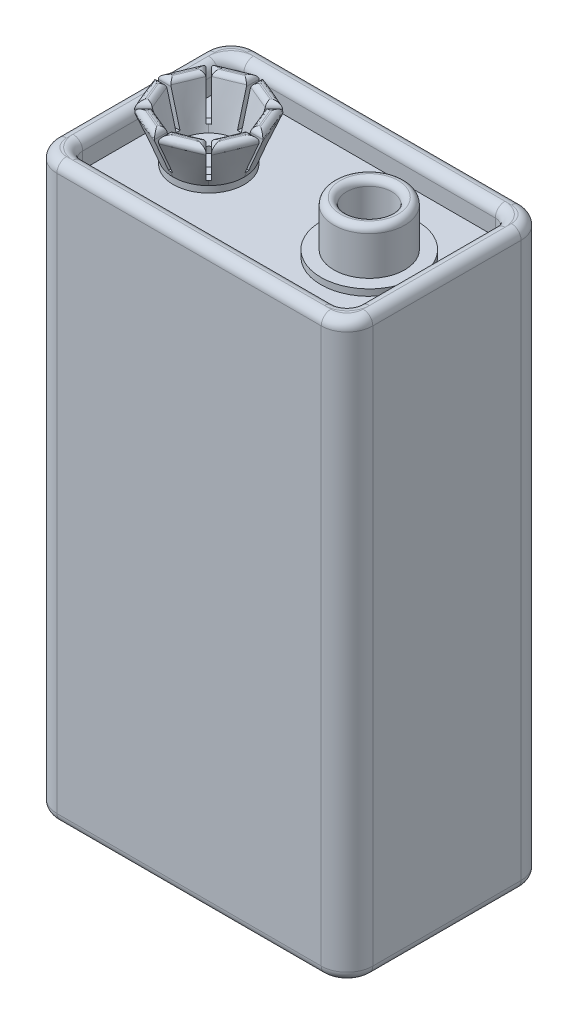
from build123d import *

# Parameters (mm, degrees)
BOSS_EXTRUDE1_DEPTH = 44.5
CUT_EXTRUDE1_DEPTH  = 2
FILLET1_R           = 0.75
BOSS_EXTRUDE2_DEPTH = 1
FILLET2_R           = 0.5
CUT_EXTRUDE2_DEPTH  = 2
FILLET4_R           = 0.75
SKETCH5_R           = 3.75
BOSS_EXTRUDE3_DEPTH = 0.5
SKETCH6_R           = 2.75
SKETCH6_R_2         = 1.75
BOSS_EXTRUDE4_DEPTH = 3.5
SKETCH7_R           = 1
CUT_EXTRUDE3_DEPTH  = 0.5
FILLET6_R           = 0.5
SKETCH8_R           = 2.75
BOSS_EXTRUDE5_DEPTH = 0.5
SKETCH16_W          = 0.3
SKETCH16_H          = 9
CUT_EXTRUDE4_DEPTH  = 3
CIRPATTERN1_COUNT   = 8
FILLET7_R           = 0.4
SKETCH19_R          = 1
CUT_EXTRUDE5_DEPTH  = 0.5


with BuildPart() as part:
    # Sketch1 → Boss-Extrude1 (new body)
    with BuildSketch(Plane(origin=(0, 0, 0), x_dir=(1, 0, 0), z_dir=(0, 1, 0))):
        with BuildLine():
            Line((-10.25, -7.75), (10.25, -7.75))
            ThreePointArc((10.25, -7.75), (11.664213562, -7.164213562), (12.25, -5.75))
            Line((12.25, -5.75), (12.25, 5.75))
            ThreePointArc((12.25, 5.75), (11.664213562, 7.164213562), (10.25, 7.75))
            Line((10.25, 7.75), (-10.25, 7.75))
            ThreePointArc((-10.25, 7.75), (-11.664213562, 7.164213562), (-12.25, 5.75))
            Line((-12.25, 5.75), (-12.25, -5.75))
            ThreePointArc((-12.25, -5.75), (-11.664213562, -7.164213562), (-10.25, -7.75))
        make_face()
    extrude(amount=BOSS_EXTRUDE1_DEPTH)

    # Sketch2 → Cut-Extrude1 (cut)
    with BuildSketch(Plane(origin=(0, 0, 0), x_dir=(-1, 0, 0), z_dir=(0, -1, 0))):
        with BuildLine():
            Line((9.25, 6.25), (-9.25, 6.25))
            ThreePointArc((-9.25, 6.25), (-10.310660172, 5.810660172), (-10.75, 4.75))
            Line((-10.75, 4.75), (-10.75, -4.75))
            ThreePointArc((-10.75, -4.75), (-10.310660172, -5.810660172), (-9.25, -6.25))
            Line((-9.25, -6.25), (9.25, -6.25))
            ThreePointArc((9.25, -6.25), (10.310660172, -5.810660172), (10.75, -4.75))
            Line((10.75, -4.75), (10.75, 4.75))
            ThreePointArc((10.75, 4.75), (10.310660172, 5.810660172), (9.25, 6.25))
        make_face()
    extrude(amount=-CUT_EXTRUDE1_DEPTH, mode=Mode.SUBTRACT)

    # Fillet1
    fillet1_edges = [part.edges().sort_by_distance(p)[0] for p in [
        (12.25, 0, 0),
        (11.664213562, 0, 7.164213562),
        (10.310660172, 0, -5.810660172),
        (10.75, 0, 0),
        (10.310660172, 0, 5.810660172),
        (0, 0, 6.25),
        (-10.310660172, 0, 5.810660172),
        (-10.75, 0, 0),
        (-10.310660172, 0, -5.810660172),
        (0, 0, -6.25),
        (0, 0, 7.75),
        (-11.664213562, 0, 7.164213562),
        (-12.25, 0, 0),
        (-11.664213562, 0, -7.164213562),
        (0, 0, -7.75),
        (11.664213562, 0, -7.164213562),
    ]]
    fillet(fillet1_edges, radius=FILLET1_R - 0.0001)  # a hair under: the kernel refuses the full size

    # Sketch3 → Boss-Extrude2 (add)
    with BuildSketch(Plane(origin=(0, 2, 0), x_dir=(-1, 0, 0), z_dir=(0, -1, 0))):
        with BuildLine():
            Line((9, 5.5), (-9, 5.5))
            ThreePointArc((-9, 5.5), (-9.707106781, 5.207106781), (-10, 4.5))
            Line((-10, 4.5), (-10, -4.5))
            ThreePointArc((-10, -4.5), (-9.707106781, -5.207106781), (-9, -5.5))
            Line((-9, -5.5), (9, -5.5))
            ThreePointArc((9, -5.5), (9.707106781, -5.207106781), (10, -4.5))
            Line((10, -4.5), (10, 4.5))
            ThreePointArc((10, 4.5), (9.707106781, 5.207106781), (9, 5.5))
        make_face()
    extrude(amount=BOSS_EXTRUDE2_DEPTH)

    # Fillet2
    fillet2_edges = [part.edges().sort_by_distance(p)[0] for p in [
        (0, 1, -5.5),
        (-9.707106781, 1, -5.207106781),
        (-10, 1, 0),
        (-9.707106781, 1, 5.207106781),
        (0, 1, 5.5),
        (9.707106781, 1, 5.207106781),
        (10, 1, 0),
        (9.707106781, 1, -5.207106781),
        (-10, 2, 0),
        (-9.707106781, 2, 5.207106781),
        (0, 2, 5.5),
        (9.707106781, 2, 5.207106781),
        (10, 2, 0),
        (9.707106781, 2, -5.207106781),
        (0, 2, -5.5),
        (-9.707106781, 2, -5.207106781),
    ]]
    fillet(fillet2_edges, radius=FILLET2_R - 0.0001)  # a hair under: the kernel refuses the full size

    # Sketch4 → Cut-Extrude2 (cut)
    with BuildSketch(Plane(origin=(0, 44.5, 0), x_dir=(1, 0, 0), z_dir=(0, 1, 0))):
        with BuildLine():
            Line((-9.75, -6.25), (9.75, -6.25))
            ThreePointArc((9.75, -6.25), (10.457106781, -5.957106781), (10.75, -5.25))
            Line((10.75, -5.25), (10.75, 5.25))
            ThreePointArc((10.75, 5.25), (10.457106781, 5.957106781), (9.75, 6.25))
            Line((9.75, 6.25), (-9.75, 6.25))
            ThreePointArc((-9.75, 6.25), (-10.457106781, 5.957106781), (-10.75, 5.25))
            Line((-10.75, 5.25), (-10.75, -5.25))
            ThreePointArc((-10.75, -5.25), (-10.457106781, -5.957106781), (-9.75, -6.25))
        make_face()
    extrude(amount=-CUT_EXTRUDE2_DEPTH, mode=Mode.SUBTRACT)

    # Fillet4
    fillet4_edges = [part.edges().sort_by_distance(p)[0] for p in [
        (11.664213562, 44.5, -7.164213562),
        (0, 44.5, -7.75),
        (-11.664213562, 44.5, -7.164213562),
        (10.457106781, 44.5, 5.957106781),
        (10.75, 44.5, 0),
        (10.457106781, 44.5, -5.957106781),
        (0, 44.5, -6.25),
        (-10.457106781, 44.5, -5.957106781),
        (-10.75, 44.5, 0),
        (-10.457106781, 44.5, 5.957106781),
        (0, 44.5, 6.25),
        (-12.25, 44.5, 0),
        (-11.664213562, 44.5, 7.164213562),
        (0, 44.5, 7.75),
        (11.664213562, 44.5, 7.164213562),
        (12.25, 44.5, 0),
    ]]
    fillet(fillet4_edges, radius=FILLET4_R - 0.0001)  # a hair under: the kernel refuses the full size

    # Sketch5 → Boss-Extrude3 (add)
    with BuildSketch(Plane(origin=(0, 42.5, 0), x_dir=(1, 0, 0), z_dir=(0, 1, 0))):
        with Locations(Location((6.225, 0, 0), (0, 0, 270))):
            Circle(SKETCH5_R)
    extrude(amount=BOSS_EXTRUDE3_DEPTH)

    # Sketch6 → Boss-Extrude4 (add)
    with BuildSketch(Plane(origin=(0, 43, 0), x_dir=(1, 0, 0), z_dir=(0, 1, 0))):
        with Locations(Location((6.225, 0, 0), (0, 0, 270))):
            Circle(SKETCH6_R)
        with Locations(Location((6.225, 0, 0), (0, 0, 270))):
            Circle(SKETCH6_R_2, mode=Mode.SUBTRACT)
    extrude(amount=BOSS_EXTRUDE4_DEPTH)

    # Sketch7 → Cut-Extrude3 (cut)
    with BuildSketch(Plane(origin=(0, 43, 0), x_dir=(1, 0, 0), z_dir=(0, 1, 0))):
        with Locations(Location((6.225, 0, 0), (0, 0, 270))):
            Circle(SKETCH7_R)
    extrude(amount=-CUT_EXTRUDE3_DEPTH, mode=Mode.SUBTRACT)

    # Fillet6
    fillet6_edges = [part.edges().sort_by_distance(p)[0] for p in [
        (6.225, 46.5, -2.75),
        (6.225, 46.5, -1.75),
    ]]
    fillet(fillet6_edges, radius=FILLET6_R - 0.0001)  # a hair under: the kernel refuses the full size

    # Sketch8 → Boss-Extrude5 (add)
    with BuildSketch(Plane(origin=(0, 42.5, 0), x_dir=(1, 0, 0), z_dir=(0, 1, 0))):
        with Locations(Location((-6.225, 0, 0), (0, 0, 270))):
            Circle(SKETCH8_R)
    extrude(amount=BOSS_EXTRUDE5_DEPTH)

    # Sketch11 for Loft1 → Loft1 section 0
    with BuildSketch(Plane(origin=(0, 43, 0), x_dir=(1, 0, 0), z_dir=(0, 1, 0))):
        with BuildLine():
            # circular arc as an exact rational Bezier (weights 1, cos(half-angle), 1)
            Bezier((-4.273299788, 1.937360648), (-5.075780844, 2.745781346), (-6.214860397, 2.749981307), weights=[1, 0.923879533, 1])
            Bezier((-6.214860397, 2.749981307), (-7.353939951, 2.754181268), (-8.162360648, 1.951700212), weights=[1, 0.923879533, 1])
            Bezier((-8.162360648, 1.951700212), (-8.970781346, 1.149219156), (-8.974981307, 0.010139603), weights=[1, 0.923879533, 1])
            Bezier((-8.974981307, 0.010139603), (-8.979181268, -1.128939951), (-8.176700212, -1.937360648), weights=[1, 0.923879533, 1])
            Bezier((-8.176700212, -1.937360648), (-7.374219156, -2.745781346), (-6.235139603, -2.749981307), weights=[1, 0.923879533, 1])
            Bezier((-6.235139603, -2.749981307), (-5.096060049, -2.754181268), (-4.287639352, -1.951700212), weights=[1, 0.923879533, 1])
            Bezier((-4.287639352, -1.951700212), (-3.479218654, -1.149219156), (-3.475018693, -0.010139603), weights=[1, 0.923879533, 1])
            Bezier((-3.475018693, -0.010139603), (-3.470818732, 1.128939951), (-4.273299788, 1.937360648), weights=[1, 0.923879533, 1])
        make_face()
    # Sketch9 → Loft1 section 1
    with BuildSketch(Plane(origin=(0, 46.5, 0), x_dir=(1, 0, 0), z_dir=(0, 1, 0))):
        with BuildLine():
            Line((-3.152265328, 3.050158625), (-6.209036324, 4.329539371))
            Line((-6.209036324, 4.329539371), (-9.275158625, 3.072734672))
            Line((-9.275158625, 3.072734672), (-10.554539371, 0.015963676))
            Line((-10.554539371, 0.015963676), (-9.297734672, -3.050158625))
            Line((-9.297734672, -3.050158625), (-6.240963676, -4.329539371))
            Line((-6.240963676, -4.329539371), (-3.174841375, -3.072734672))
            Line((-3.174841375, -3.072734672), (-1.895460629, -0.015963676))
            Line((-1.895460629, -0.015963676), (-3.152265328, 3.050158625))
        make_face()
    loft()

    # Sketch12 for Cut-Loft1 → Cut-Loft1 section 0
    with BuildSketch(Plane(origin=(0, 43, 0), x_dir=(1, 0, 0), z_dir=(0, 1, 0))):
        with BuildLine():
            Bezier((-3.975, 0), (-3.975, 0.931980515), (-4.634009742, 1.590990258), weights=[1, 0.923879533, 1])
            Bezier((-4.634009742, 1.590990258), (-5.293019485, 2.25), (-6.225, 2.25), weights=[1, 0.923879533, 1])
            Bezier((-6.225, 2.25), (-7.156980515, 2.25), (-7.815990258, 1.590990258), weights=[1, 0.923879533, 1])
            Bezier((-7.815990258, 1.590990258), (-8.475, 0.931980515), (-8.475, 0), weights=[1, 0.923879533, 1])
            Bezier((-8.475, 0), (-8.475, -0.931980515), (-7.815990258, -1.590990258), weights=[1, 0.923879533, 1])
            Bezier((-7.815990258, -1.590990258), (-7.156980515, -2.25), (-6.225, -2.25), weights=[1, 0.923879533, 1])
            Bezier((-6.225, -2.25), (-5.293019485, -2.25), (-4.634009742, -1.590990258), weights=[1, 0.923879533, 1])
            Bezier((-4.634009742, -1.590990258), (-3.975, -0.931980515), (-3.975, 0), weights=[1, 0.923879533, 1])
        make_face()
    # Sketch14 → Cut-Loft1 section 1
    with BuildSketch(Plane(origin=(0, 46.5, 0), x_dir=(1, 0, 0), z_dir=(0, 1, 0))):
        with BuildLine():
            Line((-2.977823399, 0), (-3.928899406, 2.296100594))
            Line((-3.928899406, 2.296100594), (-6.225, 3.247176601))
            Line((-6.225, 3.247176601), (-8.521100594, 2.296100594))
            Line((-8.521100594, 2.296100594), (-9.472176601, 0))
            Line((-9.472176601, 0), (-8.521100594, -2.296100594))
            Line((-8.521100594, -2.296100594), (-6.225, -3.247176601))
            Line((-6.225, -3.247176601), (-3.928899406, -2.296100594))
            Line((-3.928899406, -2.296100594), (-2.977823399, 0))
        make_face()
    loft(mode=Mode.SUBTRACT)

    # Sketch16 → Cut-Extrude4 (cut)
    with BuildSketch(Plane(origin=(0, 46.5, 0), x_dir=(1, 0, 0), z_dir=(0, 1, 0))):
        with Locations((-6.225, 0)):
            Rectangle(SKETCH16_W, SKETCH16_H)
    cut_extrude4 = extrude(amount=-CUT_EXTRUDE4_DEPTH, mode=Mode.SUBTRACT)

    # CirPattern1: Cut-Extrude4 ×8 about axis
    cirpattern1_axis = Axis((-6.225, 0, 0), (0, 1, 0))
    for i in range(1, CIRPATTERN1_COUNT):
        add(cut_extrude4.rotate(cirpattern1_axis, i * 360 / CIRPATTERN1_COUNT), mode=Mode.SUBTRACT)

    # Fillet7
    fillet7_edges = [part.edges().sort_by_distance(p)[0] for p in [
        (-4.692143872, 46.5, 3.694677544),
        (-6.075, 46.5, 3.723277682),
        (-5.076949703, 46.5, 2.771638598),
        (-3.694093575, 46.5, 2.743038459),
        (-9.919677544, 46.5, 1.532856128),
        (-9.948277682, 46.5, 0.15),
        (-8.996638598, 46.5, 1.148050297),
        (-8.968038459, 46.5, 2.530906425),
        (-7.373050297, 46.5, 2.771638598),
        (-6.375, 46.5, 3.729242191),
        (-7.753638583, 46.5, 3.696424508),
        (-8.75168888, 46.5, 2.738820914),
        (-2.528575492, 46.5, 1.528638583),
        (-3.486179086, 46.5, 2.52668888),
        (-3.453361402, 46.5, 1.148050297),
        (-2.495757809, 46.5, 0.15),
        (-2.530322456, 46.5, -1.532856128),
        (-2.501722318, 46.5, -0.15),
        (-3.453361402, 46.5, -1.148050297),
        (-3.481961541, 46.5, -2.530906425),
        (-5.076949703, 46.5, -2.771638598),
        (-6.075, 46.5, -3.729242191),
        (-4.696361417, 46.5, -3.696424508),
        (-3.69831112, 46.5, -2.738820914),
        (-7.757856128, 46.5, -3.694677544),
        (-6.375, 46.5, -3.723277682),
        (-7.373050297, 46.5, -2.771638598),
        (-8.755906425, 46.5, -2.743038459),
        (-9.921424508, 46.5, -1.528638583),
        (-8.963820914, 46.5, -2.52668888),
        (-8.996638598, 46.5, -1.148050297),
        (-9.954242191, 46.5, -0.15),
    ]]
    fillet(fillet7_edges, radius=FILLET7_R)

    # Sketch19 → Cut-Extrude5 (cut)
    with BuildSketch(Plane(origin=(0, 43, 0), x_dir=(1, 0, 0), z_dir=(0, 1, 0))):
        with Locations(Location((-6.225, 0, 0), (0, 0, 270))):
            Circle(SKETCH19_R)
    extrude(amount=-CUT_EXTRUDE5_DEPTH, mode=Mode.SUBTRACT)


solid = part.part
